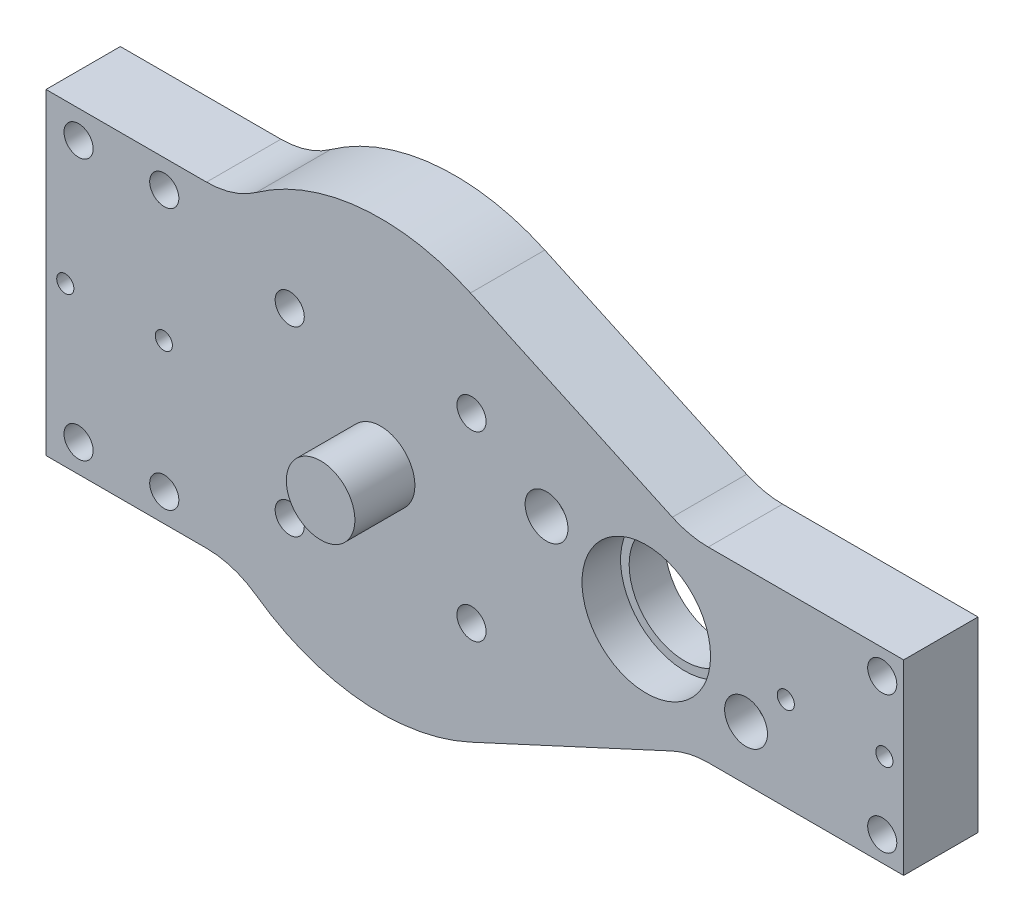
from build123d import *

# Parameters (mm, degrees)
BOSS_EXTRUDE1_DEPTH  = 4.5
SKETCH2_R            = 7.5
CUT_EXTRUDE1_DEPTH   = 50.942466899
SKETCH3_R            = 4
BOSS_EXTRUDE2_DEPTH  = 7
BOSS_EXTRUDE3_DEPTH  = 4.5
FILLET1_R            = 10
CUT_EXTRUDE4_DEPTH   = 62.754464971
SKETCH9_R            = 1
CUT_EXTRUDE5_DEPTH   = 62.182594482
SKETCH10_R           = 1.7
CUT_EXTRUDE6_DEPTH   = 2.4
CUT_EXTRUDE7_DEPTH   = 4.5
FILLET2_R            = 10
CUT_EXTRUDE8_DEPTH   = 51.658168147
SKETCH23_R           = 1
SKETCH23_R_2         = 6.5
BOSS_EXTRUDE6_DEPTH  = 4.175
BOSS_EXTRUDE7_START  = -8.675
BOSS_EXTRUDE7_DEPTH  = 8.675
SKETCH26_W           = 9
SKETCH26_H           = 21.787737724
BOSS_EXTRUDE8_DEPTH  = 33
CUT_EXTRUDE9_REACH   = 94.723
SKETCH27_R           = 5
BOSS_EXTRUDE9_DEPTH  = 8.675
BOSS_EXTRUDE10_DEPTH = 105
FILLET4_R            = 10
CUT_EXTRUDE10_DEPTH  = 9
SKETCH31_W           = 12
SKETCH31_H           = 25
CUT_EXTRUDE11_DEPTH  = 122.612556686
BOSS_EXTRUDE11_DEPTH = 10
CUT_EXTRUDE12_REACH  = 142.02
SKETCH33_W           = 10
SKETCH33_H           = 33
CUT_EXTRUDE13_REACH  = 157.049
SKETCH34_W           = 105
SKETCH34_H           = 35
SKETCH37_W           = 2
SKETCH37_H           = 21.787737724
CUT_EXTRUDE16_DEPTH  = 33
SKETCH38_R           = 1.5
CUT_EXTRUDE17_DEPTH  = 10
SKETCH39_R           = 2.5
CUT_EXTRUDE18_DEPTH  = 3.5
SKETCH40_W           = 25.280034453
SKETCH40_H           = 37
CUT_EXTRUDE19_DEPTH  = 133.5
SKETCH41_W           = 12
SKETCH41_H           = 25
BOSS_EXTRUDE12_DEPTH = 8.675
SKETCH42_W           = 13.810626618
SKETCH42_H           = 37
CUT_EXTRUDE20_DEPTH  = 70.667883159
SKETCH43_R           = 1
CUT_EXTRUDE21_DEPTH  = 70.667883159
SKETCH44_R           = 1.7
CUT_EXTRUDE22_DEPTH  = 3
SKETCH45_W           = 5
SKETCH45_H           = 21.787737724
SKETCH45_R           = 1
BOSS_EXTRUDE13_DEPTH = 8.675
SKETCH46_R           = 1.7
CUT_EXTRUDE23_DEPTH  = 3
FILLET5_R            = 1
SKETCH47_W           = 49.44871548
SKETCH47_H           = 46.533616532
CUT_EXTRUDE25_DEPTH  = 33
SKETCH51_R           = 1
CUT_EXTRUDE26_DEPTH  = 68.791165845
SKETCH52_R           = 1.675
CUT_EXTRUDE27_DEPTH  = 5


with BuildPart() as part:
    # Sketch1 → Boss-Extrude1 (new body)
    with BuildSketch(Plane.XY):
        with BuildLine():
            Line((10.483870968, 22.695560128), (36.032258065, 10.893868862))
            ThreePointArc((36.032258065, 10.893868862), (43, 0), (36.032258065, -10.893868862))
            Line((36.032258065, -10.893868862), (10.483870968, -22.695560128))
            ThreePointArc((10.483870968, -22.695560128), (-25, 0), (10.483870968, 22.695560128))
        make_face()
    extrude(amount=BOSS_EXTRUDE1_DEPTH)

    # Sketch2 → Cut-Extrude1 (cut, through all)
    with BuildSketch(Plane.XY.offset(4.5)):
        with Locations((31, 0)):
            Circle(SKETCH2_R)
    extrude(amount=-CUT_EXTRUDE1_DEPTH, mode=Mode.SUBTRACT)

    # Sketch3 → Boss-Extrude2 (add)
    with BuildSketch(Plane.XY.offset(4.5)):
        Circle(SKETCH3_R)
    extrude(amount=BOSS_EXTRUDE2_DEPTH)

    # Sketch4 → Boss-Extrude3 (add)
    with BuildSketch(Plane(origin=(0, 0, 0), x_dir=(-1, 0, 0), z_dir=(0, 0, -1))):
        with BuildLine():
            Line((-36.032258065, 10.893868862), (-56.032258065, 10.893868862))
            Line((-56.032258065, 10.893868862), (-56.032258065, -10.893868862))
            Line((-56.032258065, -10.893868862), (-36.032258065, -10.893868862))
            ThreePointArc((-36.032258065, -10.893868862), (-43, 0), (-36.032258065, 10.893868862))
        make_face()
        with BuildLine():
            Line((22.501635968, 10.893868862), (42.501635968, 10.893868862))
            Line((42.501635968, 10.893868862), (42.501635968, -10.893868862))
            Line((42.501635968, -10.893868862), (22.501635968, -10.893868862))
            ThreePointArc((22.501635968, -10.893868862), (25, 0), (22.501635968, 10.893868862))
        make_face()
    extrude(amount=-BOSS_EXTRUDE3_DEPTH)

    # Fillet1
    fillet1_edges = [part.edges().sort_by_distance(p)[0] for p in [
        (56.032258065, 10.893868862, 2.25),
        (56.032258065, -10.893868862, 2.25),
        (-42.501635968, -10.893868862, 2.25),
        (-42.501635968, 10.893868862, 2.25),
    ]]
    fillet(fillet1_edges, radius=FILLET1_R)

    # Sketch8 → Cut-Extrude4 (cut, through all)
    with BuildSketch(Plane.XY.offset(4.5)):
        with BuildLine():
            Line((56.032258065, 0.893868862), (56.032258065, -0.893868862))
            ThreePointArc((56.032258065, -0.893868862), (55.873267798, -2.669967796), (55.401352579, -4.389590243))
            Line((55.401352579, -4.389590243), (55.401352579, 4.389590243))
            ThreePointArc((55.401352579, 4.389590243), (55.873267798, 2.669967796), (56.032258065, 0.893868862))
        make_face()
        with BuildLine():
            Line((-42.501635968, -0.893868862), (-42.501635968, 0.893868862))
            ThreePointArc((-42.501635968, 0.893868862), (-42.342645701, 2.669967796), (-41.870730482, 4.389590243))
            Line((-41.870730482, 4.389590243), (-41.870730482, -4.389590243))
            ThreePointArc((-41.870730482, -4.389590243), (-42.342645701, -2.669967796), (-42.501635968, -0.893868862))
        make_face()
    extrude(amount=-CUT_EXTRUDE4_DEPTH, mode=Mode.SUBTRACT)

    # Sketch9 → Cut-Extrude5 (cut, through all)
    with BuildSketch(Plane.XY.offset(4.5)):
        with Locations((-10.606601718, 10.606601718)):
            Circle(SKETCH9_R)
        with Locations((10.606601718, 10.606601718)):
            Circle(SKETCH9_R)
        with Locations((10.606601718, -10.606601718)):
            Circle(SKETCH9_R)
        with Locations((-10.606601718, -10.606601718)):
            Circle(SKETCH9_R)
    extrude(amount=-CUT_EXTRUDE5_DEPTH, mode=Mode.SUBTRACT)

    # Sketch10 → Cut-Extrude6 (cut)
    with BuildSketch(Plane.XY.offset(4.5)):
        with Locations((-10.606601718, 10.606601718)):
            Circle(SKETCH10_R)
        with Locations((10.606601718, 10.606601718)):
            Circle(SKETCH10_R)
        with Locations((10.606601718, -10.606601718)):
            Circle(SKETCH10_R)
        with Locations((-10.606601718, -10.606601718)):
            Circle(SKETCH10_R)
    extrude(amount=-CUT_EXTRUDE6_DEPTH, mode=Mode.SUBTRACT)

    # Sketch11 → Cut-Extrude7 (cut)
    with BuildSketch(Plane(origin=(0, 0, 0), x_dir=(-1, 0, 0), z_dir=(0, 0, -1))):
        with BuildLine():
            Line((-40.960235838, 14.646128502), (-73.67178465, 18.9155259))
            Line((-73.67178465, 18.9155259), (-68.640309048, -15.675868866))
            Line((-68.640309048, -15.675868866), (-41.444996676, -13.212200821))
            ThreePointArc((-41.444996676, -13.212200821), (-43.493415761, 0.756825882), (-40.960235838, 14.646128502))
        make_face()
    extrude(amount=-CUT_EXTRUDE7_DEPTH, mode=Mode.SUBTRACT)

    # Fillet2
    # the kernel refuses this fillet: 10 mm, written as the material it takes off along each edge
    with BuildSketch(Plane(origin=(42.113817462, -10.893868862, 28.001897109), x_dir=(0.1443560651040101, 0.9895258088941827, 0), z_dir=(0, 0, -1))) as fillet2_piece_1:
        with BuildLine():
            CenterArc((8.32021185, -9.941449502), FILLET2_R, 83.796810377, 73.10182949)
            Line((-0.877909984, -6.017859982), (-1.061872421, -5.939388192))
            ThreePointArc((-1.061872421, -5.939388192), (-0.636860154, -2.980058778), (-0.197905162, 0.028871213))
            Line((-0.197905162, 0.028871213), (-0.02161094, 0.19882899))
            ThreePointArc((-0.02161094, 0.19882899), (4.700379422, 0.454694668), (9.422369784, 0.19882899))
            Line((9.422369784, 0.19882899), (9.400758844, 0))
        make_face()
    extrude(amount=51.503794219, mode=Mode.SUBTRACT)
    with BuildSketch(Plane(origin=(42.113817462, 10.893868862, 28.001897109), x_dir=(-1, 0, 0), z_dir=(0, 0, -1))) as fillet2_piece_2:
        with BuildLine():
            CenterArc((8.636247816, -9.668172893), FILLET2_R, 104.801368002, 73.10182949)
            Line((-1.357056556, -9.302293499), (-1.556922643, -9.294975911))
            ThreePointArc((-1.556922643, -9.294975911), (-1.128460387, -4.585508816), (-0.193626747, 0.050086753))
            Line((-0.193626747, 0.050086753), (0, 0.2))
            ThreePointArc((0, 0.2), (3.040779699, 0.2), (6.030465629, 0.193363458))
            Line((6.030465629, 0.193363458), (6.081559398, 0))
        make_face()
    extrude(amount=51.503794219, mode=Mode.SUBTRACT)

    # Sketch12 → Cut-Extrude8 (cut, through all)
    with BuildSketch(Plane.XY.offset(4.5)):
        with BuildLine():
            Line((-22.501635968, 10.893868862), (-42.592674389, 14.819498464))
            Line((-42.592674389, 14.819498464), (-48.148078041, -13.612584929))
            Line((-48.148078041, -13.612584929), (-27.427309778, -14.315310761))
            Line((-27.427309778, -14.315310761), (-22.501635968, -10.893868862))
            ThreePointArc((-22.501635968, -10.893868862), (-25, 0), (-22.501635968, 10.893868862))
        make_face()
    extrude(amount=-CUT_EXTRUDE8_DEPTH, mode=Mode.SUBTRACT)

    # Sketch23 → Boss-Extrude6 (add)
    with BuildSketch(Plane(origin=(0, 0, 0), x_dir=(-1, 0, 0), z_dir=(0, 0, -1))):
        with BuildLine():
            Line((-36.032258065, -10.893868862), (-10.483870968, -22.695560128))
            ThreePointArc((-10.483870968, -22.695560128), (25, 0), (-10.483870968, 22.695560128))
            Line((-10.483870968, 22.695560128), (-36.032258065, 10.893868862))
            ThreePointArc((-36.032258065, 10.893868862), (-41.287575846, 7.470998455), (-43.470874018, 1.591575362))
            ThreePointArc((-43.470874018, 1.591575362), (-43.5, 0), (-43.470874018, -1.591575362))
            ThreePointArc((-43.470874018, -1.591575362), (-41.287575846, -7.470998455), (-36.032258065, -10.893868862))
        make_face()
        with Locations(Location((-10.606601718, -10.606601718, 0), (0, 0, 180))):
            Circle(SKETCH23_R, mode=Mode.SUBTRACT)
        with Locations(Location((10.606601718, -10.606601718, 0), (0, 0, 180))):
            Circle(SKETCH23_R, mode=Mode.SUBTRACT)
        with Locations(Location((10.606601718, 10.606601718, 0), (0, 0, 180))):
            Circle(SKETCH23_R, mode=Mode.SUBTRACT)
        with Locations(Location((-10.606601718, 10.606601718, 0), (0, 0, 180))):
            Circle(SKETCH23_R, mode=Mode.SUBTRACT)
        with Locations((-31, 0)):
            Circle(SKETCH23_R_2, mode=Mode.SUBTRACT)
    extrude(amount=BOSS_EXTRUDE6_DEPTH)

    # Sketch25 → Boss-Extrude7 (add)
    with BuildSketch(Plane(origin=(0, 0, -4.175), x_dir=(-1, 0, 0), z_dir=(0, 0, -1)).offset(BOSS_EXTRUDE7_START)):
        with BuildLine():
            Line((-36.032258065, 10.893868862), (-56.032258065, 10.893868862))
            Line((-56.032258065, 10.893868862), (-56.032258065, -10.893868862))
            Line((-56.032258065, -10.893868862), (-36.032258065, -10.893868862))
            ThreePointArc((-36.032258065, -10.893868862), (-41.287575846, -7.470998455), (-43.470874018, -1.591575362))
            ThreePointArc((-43.470874018, -1.591575362), (-43.5, 0), (-43.470874018, 1.591575362))
            ThreePointArc((-43.470874018, 1.591575362), (-41.287575846, 7.470998455), (-36.032258065, 10.893868862))
        make_face()
    extrude(amount=BOSS_EXTRUDE7_DEPTH)

    # Sketch26 → Boss-Extrude8 (add)
    with BuildSketch(Plane.XY.offset(4.5)):
        with Locations((51.532258065, 0)):
            Rectangle(SKETCH26_W, SKETCH26_H)
    extrude(amount=BOSS_EXTRUDE8_DEPTH)

    # Sketch27 → Cut-Extrude9 (cut, up to next)
    with BuildSketch(Plane(origin=(56.032258065, 0, 0), x_dir=(0, 0, -1), z_dir=(1, 0, 0)), mode=Mode.PRIVATE) as cut_extrude9_sk1:
        with Locations((-29.5, 0)):
            Circle(SKETCH27_R)
    cut_extrude9_tool1 = extrude(cut_extrude9_sk1.sketch, amount=-CUT_EXTRUDE9_REACH, mode=Mode.PRIVATE) & part.part
    add(cut_extrude9_tool1.solids().sort_by_distance((56.032258, 0, 29.5))[0], mode=Mode.SUBTRACT)

    # Sketch28 → Boss-Extrude9 (add)
    with BuildSketch(Plane(origin=(0, 0, -4.175), x_dir=(-1, 0, 0), z_dir=(0, 0, -1))):
        with BuildLine():
            Line((16.815171721, 18.5), (52.85593628, 18.5))
            Line((52.85593628, 18.5), (52.85593628, -18.5))
            Line((52.85593628, -18.5), (16.815171721, -18.5))
            ThreePointArc((16.815171721, -18.5), (25, 0), (16.815171721, 18.5))
        make_face()
    extrude(amount=-BOSS_EXTRUDE9_DEPTH)

    # Sketch29 → Boss-Extrude10 (add)
    with BuildSketch(Plane.XY.offset(4.5)):
        Polygon((-52.85593628, 18.5), (-34.835554, 18.5), (-34.835554, 16.5), (-50.85593628, 16.5), (-50.85593628, -16.5), (-34.835554, -16.5), (-34.835554, -18.5), (-52.85593628, -18.5), align=None)
    extrude(amount=BOSS_EXTRUDE10_DEPTH)

    # Fillet4
    fillet4_edges = [part.edges().sort_by_distance(p)[0] for p in [
        (-16.815171721, 18.5, 0.1625),
        (-16.815171721, -18.5, 0.1625),
        (36.032258065, 10.893868862, 0.1625),
        (36.032258065, -10.893868862, 0.1625),
    ]]
    fillet(fillet4_edges, radius=FILLET4_R)

    # Sketch30 → Cut-Extrude10 (cut)
    with BuildSketch(Plane(origin=(56.032258065, 0, 0), x_dir=(0, 0, -1), z_dir=(1, 0, 0))):
        with BuildLine():
            Line((-34.192833193, 1.725490257), (-34.827272241, 0))
            Line((-34.827272241, 0), (-34.192833193, -1.725490257))
            ThreePointArc((-34.192833193, -1.725490257), (-34.5, 0), (-34.192833193, 1.725490257))
        make_face()
    extrude(amount=-CUT_EXTRUDE10_DEPTH, mode=Mode.SUBTRACT)

    # Sketch31 → Cut-Extrude11 (cut, through all)
    with BuildSketch(Plane.XY.offset(4.5)):
        with Locations((-42.794383467, 0)):
            Rectangle(SKETCH31_W, SKETCH31_H)
    extrude(amount=-CUT_EXTRUDE11_DEPTH, mode=Mode.SUBTRACT)

    # Sketch32 → Boss-Extrude11 (add)
    with BuildSketch(Plane.XY.offset(4.5)):
        Polygon((-34.835554, 18.5), (-34.835554, 16.5), (-27.732139714, 16.5), (-27.732139714, -16.5), (-34.835554, -16.5), (-34.835554, -18.5), (-27.575901827, -18.5), (-27.575901827, 18.5), align=None)
    extrude(amount=BOSS_EXTRUDE11_DEPTH)

    # Sketch33 → Cut-Extrude12 (cut, up to next)
    with BuildSketch(Plane(origin=(-27.575901827, 0, 0), x_dir=(0, 0, -1), z_dir=(1, 0, 0)), mode=Mode.PRIVATE) as cut_extrude12_sk1:
        with Locations((-9.5, 0)):
            Rectangle(SKETCH33_W, SKETCH33_H)
    cut_extrude12_tool1 = extrude(cut_extrude12_sk1.sketch, amount=-CUT_EXTRUDE12_REACH, mode=Mode.PRIVATE) & part.part
    add(cut_extrude12_tool1.solids().sort_by_distance((-27.575902, 0, 9.5))[0], mode=Mode.SUBTRACT)

    # Cut-Extrude13: up to this face of the body (flat: up to its plane)
    cut_extrude13_end = Plane(part.part.faces().sort_by_distance((-27.575901827, -17.5, 9.5))[0])
    # Sketch34 → Cut-Extrude13 (cut, up to the picked face)
    with BuildSketch(Plane(origin=(-50.85593628, 0, 0), x_dir=(0, 0, -1), z_dir=(1, 0, 0)), mode=Mode.PRIVATE) as cut_extrude13_sk1:
        with Locations((-57, 0)):
            Rectangle(SKETCH34_W, SKETCH34_H)
    cut_extrude13_tool1 = split(extrude(cut_extrude13_sk1.sketch, amount=CUT_EXTRUDE13_REACH, mode=Mode.PRIVATE), bisect_by=cut_extrude13_end, keep=Keep.BOTH, mode=Mode.PRIVATE)
    add(cut_extrude13_tool1.solids().sort_by(Axis((-50.855936, 0, 57), (1, 0, 0)))[0], mode=Mode.SUBTRACT)

    # Sketch37 → Cut-Extrude16 (cut)
    with BuildSketch(Plane.XY.offset(37.5)):
        with Locations((48.032258065, 0)):
            Rectangle(SKETCH37_W, SKETCH37_H)
    extrude(amount=-CUT_EXTRUDE16_DEPTH, mode=Mode.SUBTRACT)

    # Sketch38 → Cut-Extrude17 (cut)
    with BuildSketch(Plane.XY.offset(4.5)):
        with Locations((19.360446706, 4.557499217)):
            Circle(SKETCH38_R)
        with Locations((42.639553294, -4.557499217)):
            Circle(SKETCH38_R)
    extrude(amount=-CUT_EXTRUDE17_DEPTH, mode=Mode.SUBTRACT)

    # Sketch39 → Cut-Extrude18 (cut)
    with BuildSketch(Plane.XY.offset(4.5)):
        with Locations((19.360446706, 4.557499217)):
            Circle(SKETCH39_R)
        with Locations((42.639553294, -4.557499217)):
            Circle(SKETCH39_R)
    extrude(amount=-CUT_EXTRUDE18_DEPTH, mode=Mode.SUBTRACT)

    # Sketch40 → Cut-Extrude19 (cut)
    with BuildSketch(Plane.XY.offset(4.5)):
        with Locations((-40.215919054, 0)):
            Rectangle(SKETCH40_W, SKETCH40_H)
    extrude(amount=CUT_EXTRUDE19_DEPTH, mode=Mode.SUBTRACT)

    # Sketch41 → Boss-Extrude12 (add)
    with BuildSketch(Plane.XY.offset(4.5)):
        with Locations((-42.794383467, 0)):
            Rectangle(SKETCH41_W, SKETCH41_H)
    extrude(amount=-BOSS_EXTRUDE12_DEPTH)

    # Sketch42 → Cut-Extrude20 (cut, through all)
    with BuildSketch(Plane.XY.offset(4.5)):
        with Locations((-45.950622971, 0)):
            Rectangle(SKETCH42_W, SKETCH42_H)
    extrude(amount=-CUT_EXTRUDE20_DEPTH, mode=Mode.SUBTRACT)

    # Sketch43 → Cut-Extrude21 (cut, through all)
    with BuildSketch(Plane.XY.offset(4.5)):
        with Locations((-35.245309662, 15.250384638)):
            Circle(SKETCH43_R)
        with Locations((-35.245309662, -15.250384638)):
            Circle(SKETCH43_R)
        with Locations((-25.245309662, 15.250384638)):
            Circle(SKETCH43_R)
        with Locations((-25.245309662, -15.250384638)):
            Circle(SKETCH43_R)
    extrude(amount=-CUT_EXTRUDE21_DEPTH, mode=Mode.SUBTRACT)

    # Sketch44 → Cut-Extrude22 (cut)
    with BuildSketch(Plane.XY.offset(4.5)):
        with Locations((-35.245309662, 15.250384638)):
            Circle(SKETCH44_R)
        with Locations((-25.245309662, 15.250384638)):
            Circle(SKETCH44_R)
        with Locations((-35.245309662, -15.250384638)):
            Circle(SKETCH44_R)
        with Locations((-25.245309662, -15.250384638)):
            Circle(SKETCH44_R)
    extrude(amount=-CUT_EXTRUDE22_DEPTH, mode=Mode.SUBTRACT)

    # Sketch45 → Boss-Extrude13 (add)
    with BuildSketch(Plane(origin=(0, 0, -4.175), x_dir=(-1, 0, 0), z_dir=(0, 0, -1))):
        with Locations((-58.532258065, 0)):
            Rectangle(SKETCH45_W, SKETCH45_H)
        with Locations((-58.532258065, 8)):
            Circle(SKETCH45_R, mode=Mode.SUBTRACT)
        with Locations((-58.532258065, -8)):
            Circle(SKETCH45_R, mode=Mode.SUBTRACT)
    extrude(amount=-BOSS_EXTRUDE13_DEPTH)

    # Sketch46 → Cut-Extrude23 (cut)
    with BuildSketch(Plane.XY.offset(4.5)):
        with Locations((58.532258065, 8)):
            Circle(SKETCH46_R)
        with Locations((58.532258065, -8)):
            Circle(SKETCH46_R)
    extrude(amount=-CUT_EXTRUDE23_DEPTH, mode=Mode.SUBTRACT)

    # Fillet5
    fillet5_edges = [part.edges().sort_by_distance(p)[0] for p in [
        (49.032258065, 0, 4.5),
        (56.032258065, 0, 4.5),
    ]]
    fillet(fillet5_edges, radius=FILLET5_R)

    # Sketch47 → Cut-Extrude25 (cut)
    with BuildSketch(Plane.XY.offset(4.5)):
        with Locations((53.208425627, 0)):
            Rectangle(SKETCH47_W, SKETCH47_H)
    extrude(amount=CUT_EXTRUDE25_DEPTH, mode=Mode.SUBTRACT)

    # Sketch51 → Cut-Extrude26 (cut, through all)
    with BuildSketch(Plane(origin=(0, 0, -4.175), x_dir=(-1, 0, 0), z_dir=(0, 0, -1))):
        with Locations((36.795309662, 0)):
            Circle(SKETCH51_R)
        with Locations((25.295309662, 0)):
            Circle(SKETCH51_R)
        with Locations((-58.782258065, 0)):
            Circle(SKETCH51_R)
        with Locations((-47.282258065, 0)):
            Circle(SKETCH51_R)
    extrude(amount=-CUT_EXTRUDE26_DEPTH, mode=Mode.SUBTRACT)

    # Sketch52 → Cut-Extrude27 (cut)
    with BuildSketch(Plane(origin=(0, 0, -4.175), x_dir=(-1, 0, 0), z_dir=(0, 0, -1))):
        with Locations((36.795309662, 0)):
            Circle(SKETCH52_R)
        with Locations((25.295309662, 0)):
            Circle(SKETCH52_R)
        with Locations((-47.282258065, 0)):
            Circle(SKETCH52_R)
        with Locations((-58.782258065, 0)):
            Circle(SKETCH52_R)
    extrude(amount=-CUT_EXTRUDE27_DEPTH, mode=Mode.SUBTRACT)


solid = part.part
